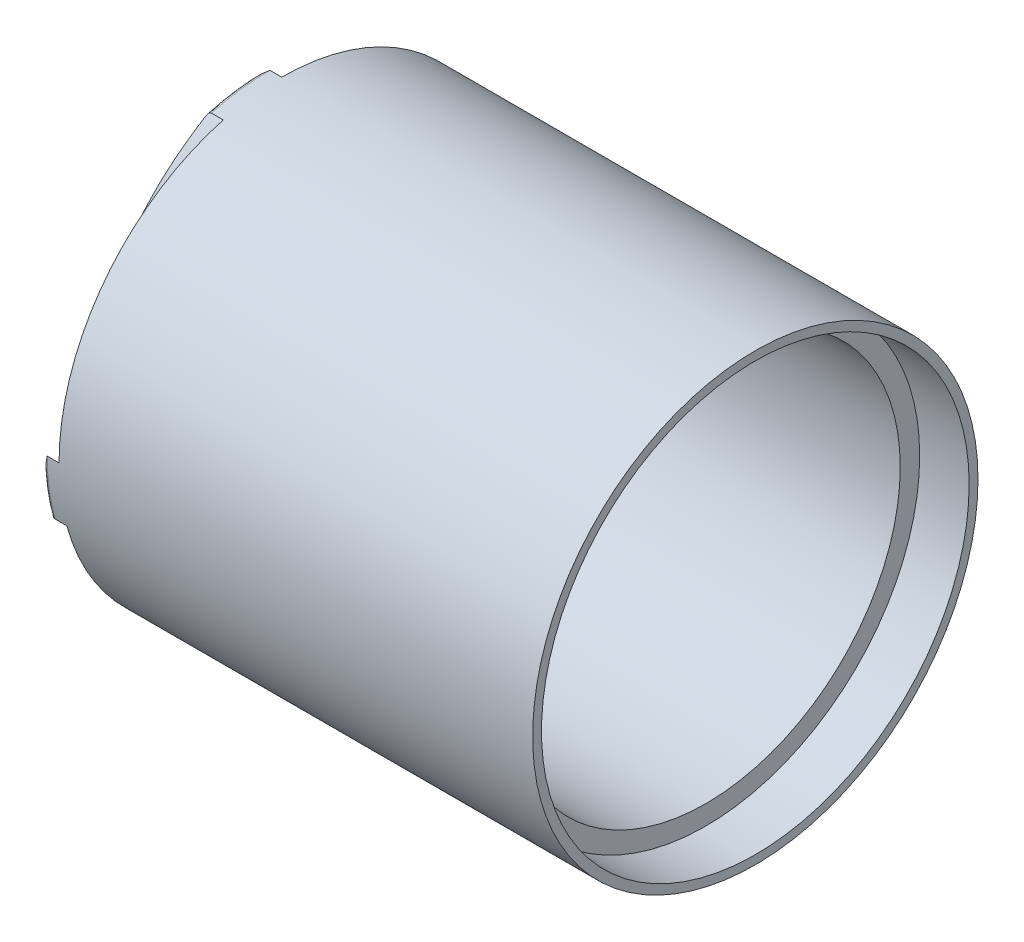
from build123d import *
from OCP.BRepFilletAPI import BRepFilletAPI_MakeChamfer
from build123d.topology import SkipClean

# Parameters (mm, degrees)
SKETCH1_R      = 31.5
SKETCH1_R_2    = 27.5
EXTRUDE1_DEPTH = 67
EXTRUDE2_START = 12
SKETCH2_R      = 2
SKETCH2_R_2    = 5
EXTRUDE2_DEPTH = 12
SKETCH3_R      = 31.5
SKETCH3_R_2    = 14.5
EXTRUDE3_DEPTH = 3
CHAMFER1_SIZE  = 7
CHAMFER1_SIZE2 = 15.431414348
FILLET1_R      = 0.5
EXTRUDE4_START = -7
SKETCH4_R      = 30.25
SKETCH4_R_2    = 27.5
EXTRUDE4_DEPTH = 7
SKETCH5_R      = 8
SKETCH5_R_2    = 5
EXTRUDE5_DEPTH = 10.4
CHAMFER2_SIZE  = 2
CHAMFER2_SIZE2 = 8.527043513


with BuildPart() as part:
    # Sketch1 → Extrude1 (new body)
    with BuildSketch(Plane(origin=(0, 0, 0), x_dir=(0, 0, -1), z_dir=(1, 0, 0))):
        Circle(SKETCH1_R)
        Circle(SKETCH1_R_2, mode=Mode.SUBTRACT)
    extrude(amount=EXTRUDE1_DEPTH)

    # Sketch2 → Extrude2 (add)
    with SkipClean():  # the faces are left unmerged after this step: merging them gives an invalid solid
        with BuildSketch(Plane.ZY.offset(EXTRUDE2_START)):
            with BuildLine():
                ThreePointArc((30.395664911, -8.267620856), (31.222695629, -4.170524865), (31.5, 0))
                ThreePointArc((31.5, 0), (22.850024535, -7.697567419), (16.209020861, 1.787773372))
                ThreePointArc((16.209020861, 1.787773372), (14.881827956, 16.825542788), (8.267620856, 30.395664911))
                ThreePointArc((8.267620856, 30.395664911), (4.170524844, 31.222695632), (-4.4e-08, 31.5))
                ThreePointArc((-4.4e-08, 31.5), (7.697567421, 22.850024557), (-1.787773372, 16.209020861))
                ThreePointArc((-1.787773372, 16.209020861), (-16.825542788, 14.881827956), (-30.395664911, 8.267620856))
                ThreePointArc((-30.395664911, 8.267620856), (-31.222695632, 4.170524843), (-31.5, -4.4e-08))
                ThreePointArc((-31.5, -4.4e-08), (-22.850024557, 7.697567421), (-16.209020861, -1.787773372))
                ThreePointArc((-16.209020861, -1.787773372), (-14.881827956, -16.825542788), (-8.267620856, -30.395664911))
                ThreePointArc((-8.267620856, -30.395664911), (-4.170524825, -31.222695635), (8.1e-08, -31.5))
                ThreePointArc((8.1e-08, -31.5), (-7.697567423, -22.850024575), (1.787773372, -16.209020861))
                ThreePointArc((1.787773372, -16.209020861), (16.825542788, -14.881827956), (30.395664911, -8.267620856))
            make_face()
            with Locations((0, 12)):
                Circle(SKETCH2_R, mode=Mode.SUBTRACT)
            with Locations((0, -12)):
                Circle(SKETCH2_R, mode=Mode.SUBTRACT)
            with Locations((12, 0)):
                Circle(SKETCH2_R, mode=Mode.SUBTRACT)
            with Locations((-12, 0)):
                Circle(SKETCH2_R, mode=Mode.SUBTRACT)
            Circle(SKETCH2_R_2, mode=Mode.SUBTRACT)
        extrude(amount=-EXTRUDE2_DEPTH)

    # Sketch3 → Extrude3 (cut)
    with SkipClean():  # the faces are left unmerged after this step: merging them gives an invalid solid
        with BuildSketch(Plane.ZY.offset(12)):
            with Locations(Location((0, 0, 0), (0, 0, 180))):
                Circle(SKETCH3_R)
            Circle(SKETCH3_R_2, mode=Mode.SUBTRACT)
        extrude(amount=-EXTRUDE3_DEPTH, mode=Mode.SUBTRACT)

    # Chamfer1: one chamfer whose edges measure the first distance from different faces: ONE call of the kernel's chamfer builder (chamfer() names one face for all edges)
    chamfer1_edges_1 = [part.edges().sort_by_distance(p)[0] for p in [
        (-9, 31.222695632, 4.170524844),
    ]]
    chamfer1_side_1 = [part.faces().sort_by_distance(p)[0] for p in [
        (-4.5, 31.222695632, 4.170524844),
    ]]
    chamfer1_edges_2 = [part.edges().sort_by_distance(p)[0] for p in [
        (-9, -4.170524865, 31.222695629),
    ]]
    chamfer1_side_2 = [part.faces().sort_by_distance(p)[0] for p in [
        (-4.5, -4.170524865, 31.222695629),
    ]]
    chamfer1_edges_3 = [part.edges().sort_by_distance(p)[0] for p in [
        (-9, -31.222695635, -4.170524825),
    ]]
    chamfer1_side_3 = [part.faces().sort_by_distance(p)[0] for p in [
        (-4.5, -31.222695635, -4.170524825),
    ]]
    chamfer1_edges_4 = [part.edges().sort_by_distance(p)[0] for p in [
        (-9, 4.170524865, -31.222695629),
    ]]
    chamfer1_side_4 = [part.faces().sort_by_distance(p)[0] for p in [
        (-4.5, 4.170524843, -31.222695632),
    ]]
    chamfer1 = BRepFilletAPI_MakeChamfer(part.part.solid().wrapped)
    for e in chamfer1_edges_1:
        chamfer1.Add(CHAMFER1_SIZE, CHAMFER1_SIZE2, e.wrapped, chamfer1_side_1[0].wrapped)  # the first distance lies on this face
    for e in chamfer1_edges_2:
        chamfer1.Add(CHAMFER1_SIZE, CHAMFER1_SIZE2, e.wrapped, chamfer1_side_2[0].wrapped)  # the first distance lies on this face
    for e in chamfer1_edges_3:
        chamfer1.Add(CHAMFER1_SIZE, CHAMFER1_SIZE2, e.wrapped, chamfer1_side_3[0].wrapped)  # the first distance lies on this face
    for e in chamfer1_edges_4:
        chamfer1.Add(CHAMFER1_SIZE, CHAMFER1_SIZE2, e.wrapped, chamfer1_side_4[0].wrapped)  # the first distance lies on this face
    add(Compound.cast(chamfer1.Shape()), mode=Mode.REPLACE)

    # Fillet1
    fillet1_edges = [part.edges().sort_by_distance(p)[0] for p in [
        (-2, 4.170524843, -31.222695632),
        (-2, 31.222695632, 4.170524844),
        (-2, -31.222695635, -4.170524825),
        (-2, -4.170524865, 31.222695629),
        (-12, 0, -5),
        (-12, 0, -14.5),
    ]]
    fillet(fillet1_edges, radius=FILLET1_R - 0.0001)  # a hair under: the kernel refuses the full size

    # Sketch4 → Extrude4 (cut)
    with BuildSketch(Plane(origin=(67, 0, 0), x_dir=(0, 0, -1), z_dir=(1, 0, 0)).offset(EXTRUDE4_START)):
        Circle(SKETCH4_R)
        with Locations(Location((0, 0, 0), (0, 0, 195.250573932))):
            Circle(SKETCH4_R_2, mode=Mode.SUBTRACT)
    extrude(amount=EXTRUDE4_DEPTH, mode=Mode.SUBTRACT)

    # Sketch5 → Extrude5 (add)
    with SkipClean():  # the faces are left unmerged after this step: merging them gives an invalid solid
        with BuildSketch(Plane(origin=(0, 0, 0), x_dir=(0, 0, -1), z_dir=(1, 0, 0))):
            with Locations(Location((0, 0, 0), (0, 0, 180))):
                Circle(SKETCH5_R)
            Circle(SKETCH5_R_2, mode=Mode.SUBTRACT)
        extrude(amount=EXTRUDE5_DEPTH)
    add(part.part.scale(1), mode=Mode.REPLACE)  # the faces are merged on a copy

    # Chamfer2
    chamfer2_edges = [part.edges().sort_by_distance(p)[0] for p in [
        (10.4, 0, -8),
    ]]
    chamfer2_side = [part.faces().sort_by_distance(p)[0] for p in [
        (10.4, 0, -7.77372583),
    ]]
    chamfer(chamfer2_edges, length=CHAMFER2_SIZE, length2=CHAMFER2_SIZE2, reference=chamfer2_side[0])


solid = part.part
